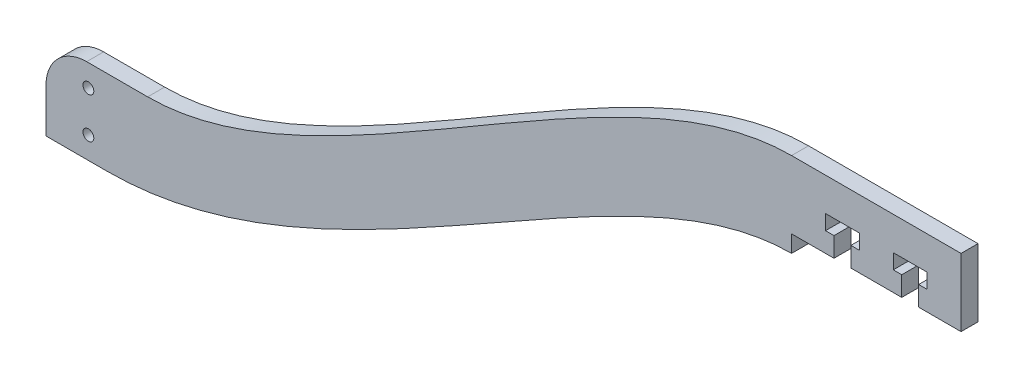
from build123d import *

# Parameters (mm, degrees)
SKETCH1_R           = 1.016
BOSS_EXTRUDE1_DEPTH = 3.175


with BuildPart() as part:
    # Sketch1 → Boss-Extrude1 (new body)
    with BuildSketch(Plane.XY):
        with BuildLine():
            Line((-139.7, -42.545), (-139.7, -50.8))
            Line((-139.7, -50.8), (-128.27, -50.8))
            add(Edge.make_bspline(
                [(-128.27, -50.8), (-84.724287152, -50.8), (-32.997851809, 0), (0, 0)],
                knots=[0, 0, 0, 0, 1, 1, 1, 1], degree=3))
            Line((0, 0), (0, 3.175))
            Line((0, 3.175), (7.9375, 3.175))
            Line((7.9375, 3.175), (7.9375, 6.858))
            Line((7.9375, 6.858), (6.35, 6.858))
            Line((6.35, 6.858), (6.35, 9.652))
            Line((6.35, 9.652), (12.7, 9.652))
            Line((12.7, 9.652), (12.7, 6.858))
            Line((12.7, 6.858), (11.1125, 6.858))
            Line((11.1125, 6.858), (11.1125, 3.175))
            Line((11.1125, 3.175), (20.6375, 3.175))
            Line((20.6375, 3.175), (20.6375, 6.858))
            Line((20.6375, 6.858), (19.05, 6.858))
            Line((19.05, 6.858), (19.05, 9.652))
            Line((19.05, 9.652), (25.4, 9.652))
            Line((25.4, 9.652), (25.4, 6.858))
            Line((25.4, 6.858), (23.8125, 6.858))
            Line((23.8125, 6.858), (23.8125, 3.175))
            Line((23.8125, 3.175), (31.75, 3.175))
            Line((31.75, 3.175), (31.75, 15.875))
            Line((31.75, 15.875), (0, 15.875))
            add(Edge.make_bspline(
                [(-120.65, -34.925), (-86.994673616, -34.925), (-33.403901093, 15.875), (0, 15.875)],
                knots=[0, 0, 0, 0, 1, 1, 1, 1], degree=3))
            Line((-120.65, -34.925), (-132.08, -34.925))
            ThreePointArc((-132.08, -34.925), (-137.468153673, -37.156846327), (-139.7, -42.545))
        make_face()
        with Locations((-131.7625, -39.0525)):
            Circle(SKETCH1_R, mode=Mode.SUBTRACT)
        with Locations((-131.7625, -46.6725)):
            Circle(SKETCH1_R, mode=Mode.SUBTRACT)
    extrude(amount=BOSS_EXTRUDE1_DEPTH)


solid = part.part
